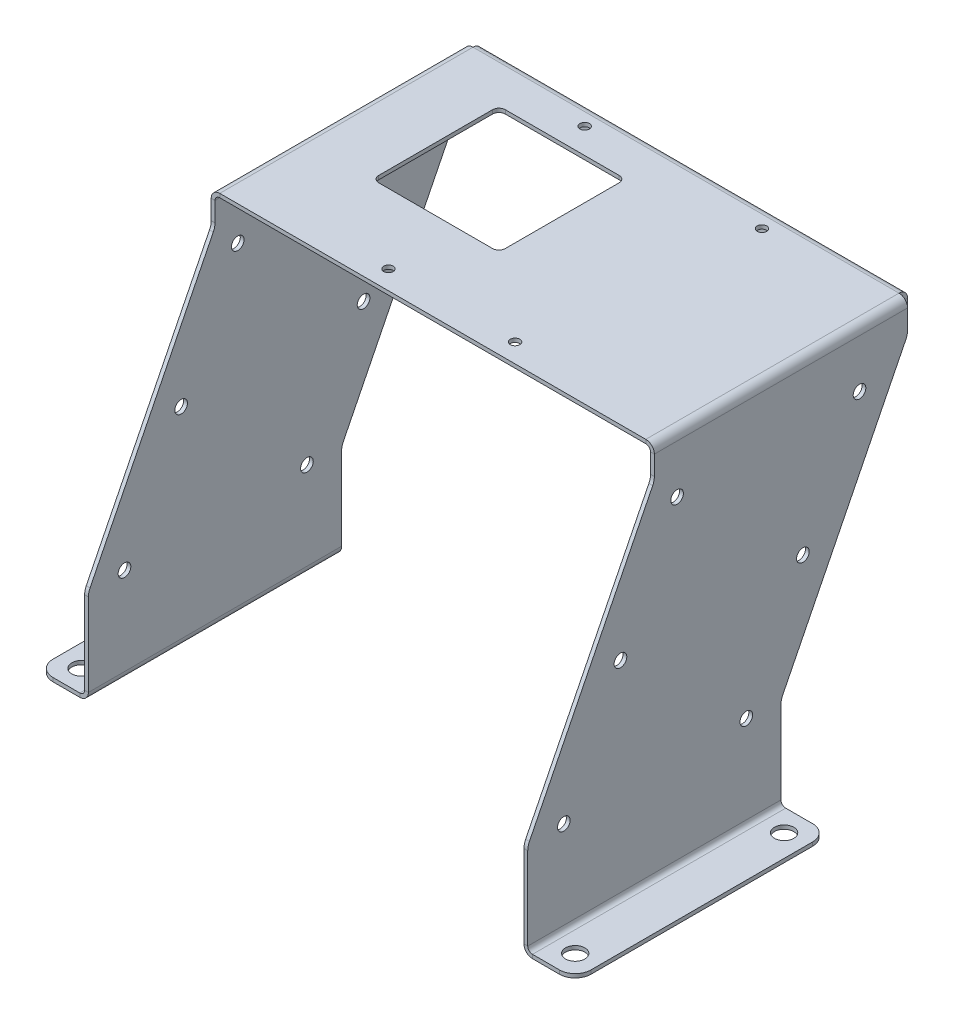
from build123d import *

# Parameters (mm, degrees)
SM_BASE_FLANGE_1_DEPTH   = 60
CUT_EXTRUDE_1_DEPTH      = 158.919093209
CUT_EXTRUDE_1_DEPTH_BACK = 158.919093209
FILLET_1_R               = 5
SM_EDGE_FLANGE_1_DEPTH   = 134.6
HOLE_WIZARD_6_1_6_1_1_D  = 6.1
HOLE_WIZARD_3_0_3_1_D    = 3
CUT_EXTRUDE_2_DEPTH      = 10
HOLE_WIZARD_4_0_4_1_D    = 4
FILLET_2_R               = 3


# Sheet-metal steps are written as plain solids
with BuildPart() as part:
    # Sketch 1 → Базовая кромка1 (new, symmetric)
    with BuildSketch(Plane.XY):
        with BuildLine():
            Line((-85, 0), (-71.5, 0))
            ThreePointArc((-71.5, 0), (-70.439339828, 0.439339828), (-70, 1.5))
            Line((-70, 1.5), (-70, 116.1))
            ThreePointArc((-70, 116.1), (-69.209188309, 118.009188309), (-67.3, 118.8))
            Line((-67.3, 118.8), (67.3, 118.8))
            ThreePointArc((67.3, 118.8), (69.209188309, 118.009188309), (70, 116.1))
            Line((70, 116.1), (70, 1.5))
            ThreePointArc((70, 1.5), (70.439339828, 0.439339828), (71.5, 0))
            Line((71.5, 0), (85, 0))
            Line((85, 0), (85, -1.2))
            Line((85, -1.2), (71.5, -1.2))
            ThreePointArc((71.5, -1.2), (69.590811691, -0.409188309), (68.8, 1.5))
            Line((68.8, 1.5), (68.8, 116.1))
            ThreePointArc((68.8, 116.1), (68.360660172, 117.160660172), (67.3, 117.6))
            Line((67.3, 117.6), (-67.3, 117.6))
            ThreePointArc((-67.3, 117.6), (-68.360660172, 117.160660172), (-68.8, 116.1))
            Line((-68.8, 116.1), (-68.8, 1.5))
            ThreePointArc((-68.8, 1.5), (-69.590811691, -0.409188309), (-71.5, -1.2))
            Line((-71.5, -1.2), (-85, -1.2))
            Line((-85, -1.2), (-85, 0))
        make_face()
    extrude(amount=SM_BASE_FLANGE_1_DEPTH, both=True)

    # Эскиз6 → Вырез-Вытянуть1 (cut, two sides: drawn at the far end of the back side and taken through both)
    with BuildSketch(Plane(origin=(0, 0, 0), x_dir=(0, 0, -1), z_dir=(1, 0, 0)).offset(-CUT_EXTRUDE_1_DEPTH_BACK)):
        Polygon((-60, 28.8), (-20, 108.8), (-20, 118.8), (-60, 118.8), align=None)
        Polygon((60, 108.8), (20, 28.8), (20, -1.2), (60, -1.2), align=None)
    extrude(amount=CUT_EXTRUDE_1_DEPTH + CUT_EXTRUDE_1_DEPTH_BACK, mode=Mode.SUBTRACT)

    # Скругление1
    fillet_1_edges = [part.edges().sort_by_distance(p)[0] for p in [
        (-69.4, 108.8, -60),
        (-69.4, 28.8, -20),
        (-85, -0.6, -20),
        (69.4, 108.8, -60),
        (69.4, 28.8, -20),
        (85, -0.6, -20),
        (69.4, 28.8, 60),
        (69.4, 108.8, 20),
        (-69.4, 28.8, 60),
        (-69.4, 108.8, 20),
        (-85, -0.6, 60),
        (85, -0.6, 60),
    ]]
    fillet(fillet_1_edges, radius=FILLET_1_R)

    # Ребро-кромка1 section (across the edge) → Ребро-кромка1 (add)
    with BuildSketch(Plane(origin=(-67.3, 117.6, -61.5), x_dir=(0, 0, 1), z_dir=(1, 0, 0))):
        with BuildLine():
            Line((-1.2, 1.5), (-1.2, 8.8))
            Line((-1.2, 8.8), (0, 8.8))
            Line((0, 8.8), (0, 1.5))
            ThreePointArc((0, 1.5), (0.439339828, 0.439339828), (1.5, 0))
            Line((1.5, 0), (1.5, -1.2))
            ThreePointArc((1.5, -1.2), (-0.409188309, -0.409188309), (-1.2, 1.5))
        make_face()
    extrude(amount=SM_EDGE_FLANGE_1_DEPTH)

    # Диаметр отверстия Ø6.1 (6.1)1 (through all)
    with Locations(Plane(origin=(0, 0, 0), x_dir=(1, 0, 0), z_dir=(0, 1, 0))):
        with Locations((-78, 13), (-78, -53), (78, -53), (78, 13)):
            Hole(HOLE_WIZARD_6_1_6_1_1_D / 2)

    # Диаметр отверстия Ø3.0 (3)1 (through all)
    with Locations(Plane(origin=(0, 117.6, 0), x_dir=(-1, 0, 0), z_dir=(0, -1, 0))):
        with Locations((-20, -14), (-28, 56), (28, 56), (20, -14)):
            Hole(HOLE_WIZARD_3_0_3_1_D / 2)

    # Эскиз14 → Вырез-Вытянуть2 (cut)
    with BuildSketch(Plane.XZ.offset(-117.6)):
        with BuildLine():
            Line((-9.1, -8), (-45.1, -8))
            ThreePointArc((-45.1, -8), (-46.514213562, -8.585786438), (-47.1, -10))
            Line((-47.1, -10), (-47.1, -46))
            ThreePointArc((-47.1, -46), (-46.514213562, -47.414213562), (-45.1, -48))
            Line((-45.1, -48), (-9.1, -48))
            ThreePointArc((-9.1, -48), (-7.685786438, -47.414213562), (-7.1, -46))
            Line((-7.1, -46), (-7.1, -10))
            ThreePointArc((-7.1, -10), (-7.685786438, -8.585786438), (-9.1, -8))
        make_face()
    extrude(amount=-CUT_EXTRUDE_2_DEPTH, mode=Mode.SUBTRACT)

    # Диаметр отверстия Ø4.0 (4)1 (through all)
    with Locations(Plane(origin=(70, 0, 0), x_dir=(0, 0, -1), z_dir=(1, 0, 0))):
        with Locations((-12.819660113, 100.8), (44.819660113, 100.8), (26.931116293, 65.02291236), (-30.708203932, 65.02291236), (-48.596747752, 29.24582472), (9.042572473, 29.24582472)):
            Hole(HOLE_WIZARD_4_0_4_1_D / 2)

    # Скругление2
    fillet_2_edges = [part.edges().sort_by_distance(p)[0] for p in [
        (-67.3, 108.8, -62.1),
        (67.3, 108.8, -62.1),
    ]]
    fillet(fillet_2_edges, radius=FILLET_2_R)


solid = part.part
